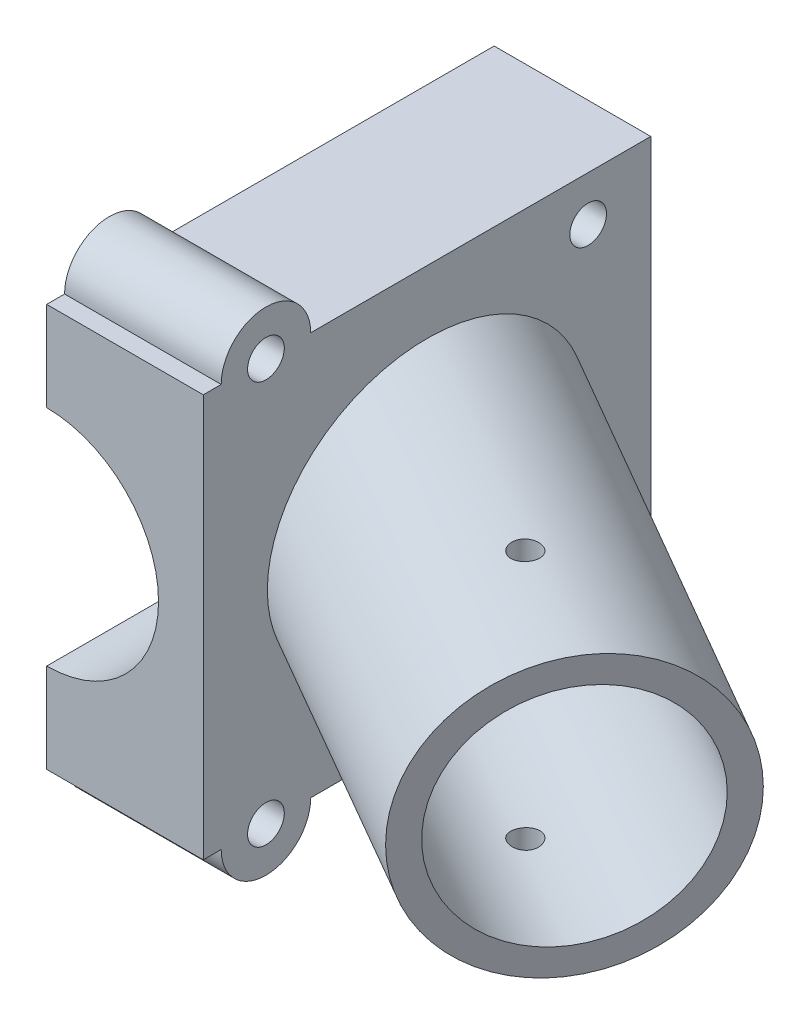
from build123d import *
from build123d.topology import SkipClean

# Parameters (mm, degrees)
BOSS_EXTRUDE1_DEPTH             = 25
BOSS_EXTRUDE2_REACH             = 65.362
BOSS_EXTRUDE2_DIRECTION_2_DEPTH = 30
SKETCH9_R                       = 2.05
CUT_EXTRUDE3_DEPTH              = 35
BOSS_EXTRUDE5_REACH             = 62.904
SKETCH13_R                      = 1.55
CUT_EXTRUDE4_DEPTH              = 87.217897417
SKETCH16_W                      = 50
SKETCH16_H                      = 45
CUT_EXTRUDE5_DEPTH              = 17.5
BOSS_EXTRUDE6_DEPTH             = 17.5
SKETCH20_R                      = 2.05
CUT_EXTRUDE6_DEPTH              = 17.5


with BuildPart() as part:
    # Sketch1 → Boss-Extrude1 (new, symmetric)
    with BuildSketch(Plane.XY):
        with BuildLine():
            Line((-17.5, 22.5), (-17.5, 0))
            Line((-17.5, 0), (17.5, 0))
            Line((17.5, 0), (17.5, 22.5))
            Line((17.5, 22.5), (12.5, 22.5))
            ThreePointArc((12.5, 22.5), (0, 10), (-12.5, 22.5))
            Line((-12.5, 22.5), (-17.5, 22.5))
        make_face()
    boss_extrude1 = extrude(amount=BOSS_EXTRUDE1_DEPTH, both=True)

    # Boss-Extrude2: up to this face of the body (flat: up to its plane)
    boss_extrude2_end = Plane(part.part.faces().sort_by_distance((17.5, 11.25, 0))[0])
    # Sketch5 → Boss-Extrude2 (add, up to the picked face)
    with BuildSketch(Plane(origin=(26.115381057, 0, 15.077722283), x_dir=(0.500000000000001, 0, -0.8660254037844382), z_dir=(0.8660254037844382, 0, 0.500000000000001)), mode=Mode.PRIVATE) as boss_extrude2_sk1:
        with BuildLine():
            Line((-6.7, 22.5), (-3.75, 22.5))
            ThreePointArc((-3.75, 22.5), (8.75, 10), (21.25, 22.5))
            Line((21.25, 22.5), (24.2, 22.5))
            ThreePointArc((24.2, 22.5), (8.75, 7.05), (-6.7, 22.5))
        make_face()
    boss_extrude2_tool1 = split(extrude(boss_extrude2_sk1.sketch, amount=-BOSS_EXTRUDE2_REACH, mode=Mode.PRIVATE), bisect_by=boss_extrude2_end, keep=Keep.BOTH, mode=Mode.PRIVATE)
    boss_extrude2 = boss_extrude2_tool1.solids().sort_by(Axis((23.502881, 22.154527, 19.602705), (-0.8660254037844382, 0, -0.500000000000001)))[0]
    add(boss_extrude2)

    # Sketch5 → Boss-Extrude2 direction 2 (add)
    with BuildSketch(Plane(origin=(26.115381057, 0, 15.077722283), x_dir=(0.500000000000001, 0, -0.8660254037844382), z_dir=(0.8660254037844382, 0, 0.500000000000001))):
        with BuildLine():
            Line((-6.7, 22.5), (-3.75, 22.5))
            ThreePointArc((-3.75, 22.5), (8.75, 10), (21.25, 22.5))
            Line((21.25, 22.5), (24.2, 22.5))
            ThreePointArc((24.2, 22.5), (8.75, 7.05), (-6.7, 22.5))
        make_face()
    boss_extrude2_direction_2 = extrude(amount=BOSS_EXTRUDE2_DIRECTION_2_DEPTH)

    # Sketch9 → Cut-Extrude3 (cut)
    with BuildSketch(Plane.ZY.offset(17.5)):
        with Locations((-18, 5)):
            Circle(SKETCH9_R)
    cut_extrude3 = extrude(amount=-CUT_EXTRUDE3_DEPTH, mode=Mode.SUBTRACT)

    # Boss-Extrude5: up to this face of the body (flat: up to its plane)
    boss_extrude5_end = Plane(part.part.faces().sort_by_distance((17.5, 17.19483523, 0))[0])
    # Sketch12 → Boss-Extrude5 (add, up to the picked face)
    with BuildSketch(Plane(origin=(21.973076211, 0, 12.686161466), x_dir=(0.4999999999999999, 0, -0.8660254037844388), z_dir=(0.8660254037844388, 0, 0.4999999999999999)), mode=Mode.PRIVATE) as boss_extrude5_sk1:
        with BuildLine():
            Line((-3.75, 22.5), (21.25, 22.5))
            ThreePointArc((21.25, 22.5), (8.75, 10), (-3.75, 22.5))
        make_face()
    boss_extrude5_tool1 = split(extrude(boss_extrude5_sk1.sketch, amount=-BOSS_EXTRUDE5_REACH, mode=Mode.PRIVATE), bisect_by=boss_extrude5_end, keep=Keep.BOTH, mode=Mode.PRIVATE)
    boss_extrude5 = boss_extrude5_tool1.solids().sort_by(Axis((26.348076, 17.194835, 5.108439), (-0.8660254037844388, 0, -0.4999999999999999)))[0]
    add(boss_extrude5)

    # Mirror1: Boss-Extrude1, Boss-Extrude2, Boss-Extrude2 direction 2, Cut-Extrude3, Boss-Extrude5 across plane
    with SkipClean():  # the faces are left unmerged after this step: merging them gives an invalid solid
        add(boss_extrude1.mirror(Plane(origin=(17.5, 22.5, 25), x_dir=(0, 0, 1), z_dir=(0, -1, 0))))
        add(boss_extrude2.mirror(Plane(origin=(17.5, 22.5, 25), x_dir=(0, 0, 1), z_dir=(0, -1, 0))))
        add(boss_extrude2_direction_2.mirror(Plane(origin=(17.5, 22.5, 25), x_dir=(0, 0, 1), z_dir=(0, -1, 0))))
        add(cut_extrude3.mirror(Plane(origin=(17.5, 22.5, 25), x_dir=(0, 0, 1), z_dir=(0, -1, 0))), mode=Mode.SUBTRACT)
        add(boss_extrude5.mirror(Plane(origin=(17.5, 22.5, 25), x_dir=(0, 0, 1), z_dir=(0, -1, 0))))

    # Sketch13 → Cut-Extrude4 (cut, through all)
    with SkipClean():  # the faces are left unmerged after this step: merging them gives an invalid solid
        with BuildSketch(Plane(origin=(0, 0, 0), x_dir=(1, 0, 0), z_dir=(0, 1, 0))):
            with Locations(Location((43.480762114, -15, 0), (0, 0, 90))):
                Circle(SKETCH13_R)
        extrude(amount=CUT_EXTRUDE4_DEPTH, mode=Mode.SUBTRACT)

    # Sketch16 → Cut-Extrude5 (cut)
    with SkipClean():  # the faces are left unmerged after this step: merging them gives an invalid solid
        with BuildSketch(Plane(origin=(0, 0, 0), x_dir=(0, 0, -1), z_dir=(1, 0, 0))):
            with Locations((0, 22.5)):
                Rectangle(SKETCH16_W, SKETCH16_H)
        extrude(amount=-CUT_EXTRUDE5_DEPTH, mode=Mode.SUBTRACT)
    add(part.part.scale(1), mode=Mode.REPLACE)  # the faces are merged on a copy

    # Sketch18 → Boss-Extrude6 (add)
    with BuildSketch(Plane.ZY):
        with BuildLine():
            Line((13, 0), (23, 0))
            ThreePointArc((23, 0), (18, -5), (13, 0))
        make_face()
    boss_extrude6 = extrude(amount=-BOSS_EXTRUDE6_DEPTH)

    # Sketch20 → Cut-Extrude6 (cut)
    with BuildSketch(Plane.ZY):
        with Locations((18, 0)):
            Circle(SKETCH20_R)
    cut_extrude6 = extrude(amount=-CUT_EXTRUDE6_DEPTH, mode=Mode.SUBTRACT)

    # Mirror2: Boss-Extrude6, Cut-Extrude6 across plane
    add(boss_extrude6.mirror(Plane.ZX.offset(22.5)))
    add(cut_extrude6.mirror(Plane.ZX.offset(22.5)), mode=Mode.SUBTRACT)


solid = part.part
